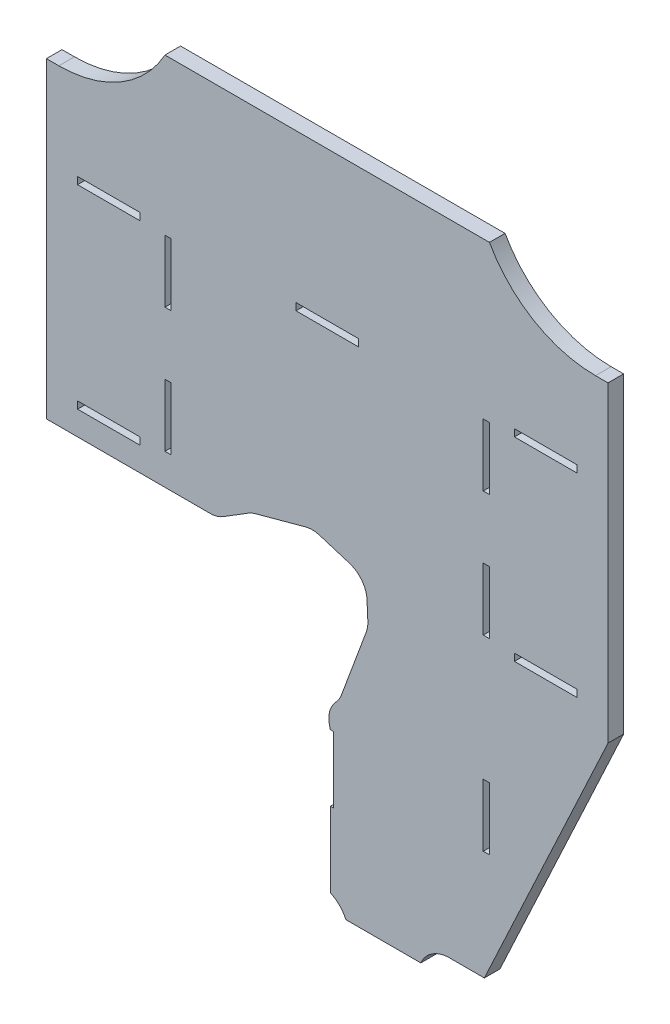
from build123d import *

# Parameters (mm, degrees)
FRAME_OUTLINE_W     = 1
FRAME_OUTLINE_H     = 0.115
FRAME_OUTLINE_W_2   = 0.1
FRAME_OUTLINE_H_2   = 1
BOSS_EXTRUDE1_DEPTH = 0.125
FILLET1_R           = 0.5
FILLET2_R           = 0.4
CUT_EXTRUDE1_DEPTH  = 12.518354917


with BuildPart() as part:
    # frame_outline → Boss-Extrude1 (new, symmetric)
    with BuildSketch(Plane.XY):
        Polygon((0.05, 0.3), (0.05, 1.5), (0.1, 1.5), (0.1, 2.562485241), (0.05, 2.562485241), (-0.008875073, 2.811860782), (0.203530984, 3.066347223), (0.655022448, 4.283241722), (0.625059951, 4.94163014), (-0.232915246, 5.208434363), (-1.213255559, 4.94163014), (-1.763721297, 4.6), (-4.5, 4.6), (-4.5, 10.6), (4.5, 10.6), (4.5, 4.6), (2.518192453, 0.35), (1.5, 0.35), (1.5, 0.05), (0.3, 0.05), (0.3, 0.3), align=None)
        with Locations((0, 8.1575)):
            Rectangle(FRAME_OUTLINE_W, FRAME_OUTLINE_H, mode=Mode.SUBTRACT)
        with Locations((-2.55, 7.6)):
            Rectangle(FRAME_OUTLINE_W_2, FRAME_OUTLINE_H_2, mode=Mode.SUBTRACT)
        with Locations((-2.55, 5.6)):
            Rectangle(FRAME_OUTLINE_W_2, FRAME_OUTLINE_H_2, mode=Mode.SUBTRACT)
        with Locations((2.55, 7.6)):
            Rectangle(FRAME_OUTLINE_W_2, FRAME_OUTLINE_H_2, mode=Mode.SUBTRACT)
        with Locations((2.55, 5.6)):
            Rectangle(FRAME_OUTLINE_W_2, FRAME_OUTLINE_H_2, mode=Mode.SUBTRACT)
        with Locations((2.55, 2.6)):
            Rectangle(FRAME_OUTLINE_W_2, FRAME_OUTLINE_H_2, mode=Mode.SUBTRACT)
        with Locations((-3.5, 8.1575)):
            Rectangle(FRAME_OUTLINE_W, FRAME_OUTLINE_H, mode=Mode.SUBTRACT)
        with Locations((3.5, 8.1575)):
            Rectangle(FRAME_OUTLINE_W, FRAME_OUTLINE_H, mode=Mode.SUBTRACT)
        with Locations((-3.5, 5.0425)):
            Rectangle(FRAME_OUTLINE_W, FRAME_OUTLINE_H, mode=Mode.SUBTRACT)
        with Locations((3.5, 5.0425)):
            Rectangle(FRAME_OUTLINE_W, FRAME_OUTLINE_H, mode=Mode.SUBTRACT)
    extrude(amount=BOSS_EXTRUDE1_DEPTH, both=True)

    # Fillet1
    # the kernel refuses this fillet: 0.5 mm, written as the material it adds along each edge
    with BuildSketch(Plane(origin=(1.5, 0.35, 0.125), x_dir=(0, -1, 0), z_dir=(0, 0, -1))) as fillet1_piece_1:
        with BuildLine():
            CenterArc((0.5, -0.458257569), FILLET1_R, 113.578178478, 66.421821522)
            Line((0, -0.458257569), (0, 0))
            Line((0, 0), (0.3, 0))
        make_face()
    extrude(amount=0.25)
    with BuildSketch(Plane(origin=(0.3, 0.3, -0.125), x_dir=(0, -1, 0), z_dir=(0, 0, 1))) as fillet1_piece_2:
        with BuildLine():
            CenterArc((0.455718914, -0.455718914), FILLET1_R, 114.295188945, 41.409622109)
            Line((0, -0.25), (0, 0))
            Line((0, 0), (0.25, 0))
        make_face()
    extrude(amount=0.25)

    # Fillet2
    fillet2_edges = [part.edges().sort_by_distance(p)[0] for p in [
        (-0.008875073, 2.811860782, 0),
        (0.203530984, 3.066347223, 0),
        (0.655022448, 4.283241722, 0),
        (0.625059951, 4.94163014, 0),
        (-0.232915246, 5.208434363, 0),
        (-1.213255559, 4.94163014, 0),
        (-1.763721297, 4.6, 0),
    ]]
    fillet(fillet2_edges, radius=FILLET2_R)

    # Sketch1 → Cut-Extrude1 (cut, through all)
    with BuildSketch(Plane.XY.offset(0.125)):
        with BuildLine():
            Line((-4.5, 9.6), (-4.5, 10.6))
            Line((-4.5, 10.6), (-2.6, 10.6))
            ThreePointArc((-2.6, 10.6), (-3.313845854, 9.868537952), (-4.3, 9.6))
            Line((-4.3, 9.6), (-4.5, 9.6))
        make_face()
        with BuildLine():
            Line((4.5, 10.6), (4.5, 9.6))
            Line((4.5, 9.6), (4.3, 9.6))
            ThreePointArc((4.3, 9.6), (3.313845854, 9.868537952), (2.6, 10.6))
            Line((2.6, 10.6), (4.5, 10.6))
        make_face()
    extrude(amount=-CUT_EXTRUDE1_DEPTH, mode=Mode.SUBTRACT)


solid = part.part
